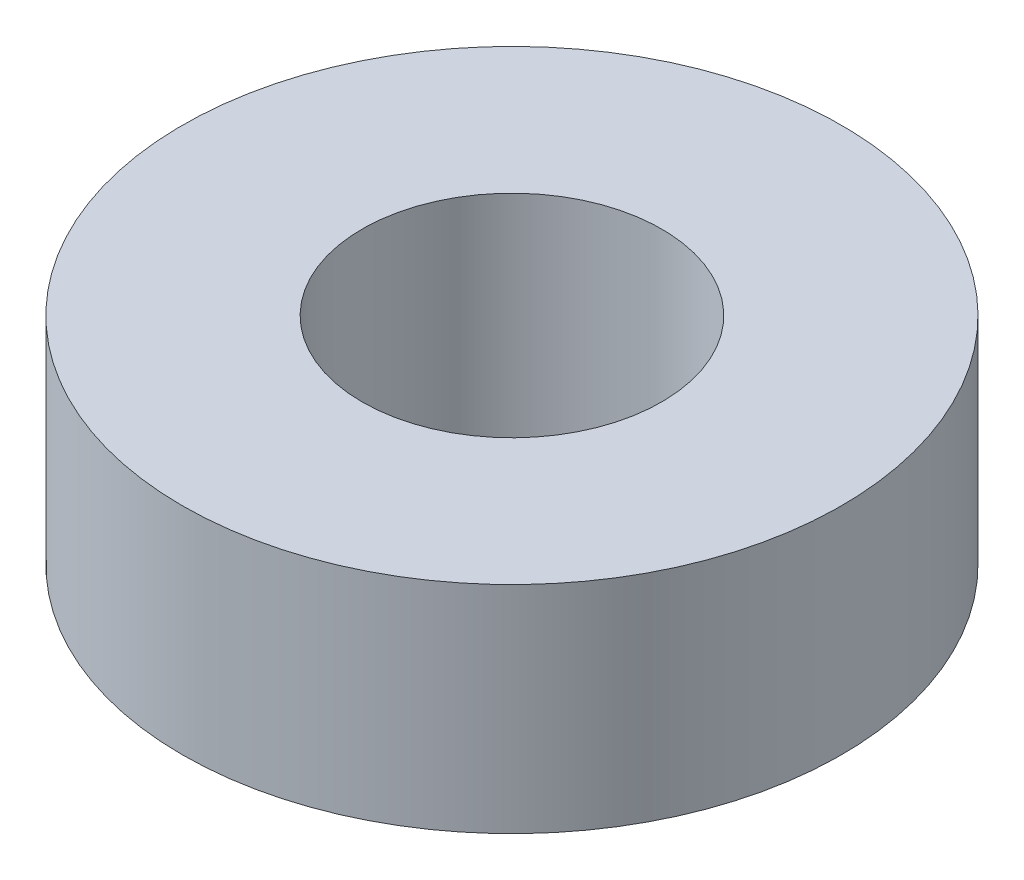
from build123d import *

# Parameters (mm, degrees)
SKETCH1_R           = 27.5
BOSS_EXTRUDE1_DEPTH = 18
SKETCH2_R           = 12.5
CUT_EXTRUDE1_DEPTH  = 43.854404674


with BuildPart() as part:
    # Sketch1 → Boss-Extrude1 (new body)
    with BuildSketch(Plane(origin=(0, 0, 0), x_dir=(1, 0, 0), z_dir=(0, 1, 0))):
        Circle(SKETCH1_R)
    extrude(amount=BOSS_EXTRUDE1_DEPTH)

    # Sketch2 → Cut-Extrude1 (cut, through all)
    with BuildSketch(Plane(origin=(0, 0, 0), x_dir=(1, 0, 0), z_dir=(0, 1, 0))):
        Circle(SKETCH2_R)
    extrude(amount=CUT_EXTRUDE1_DEPTH, mode=Mode.SUBTRACT)


solid = part.part
